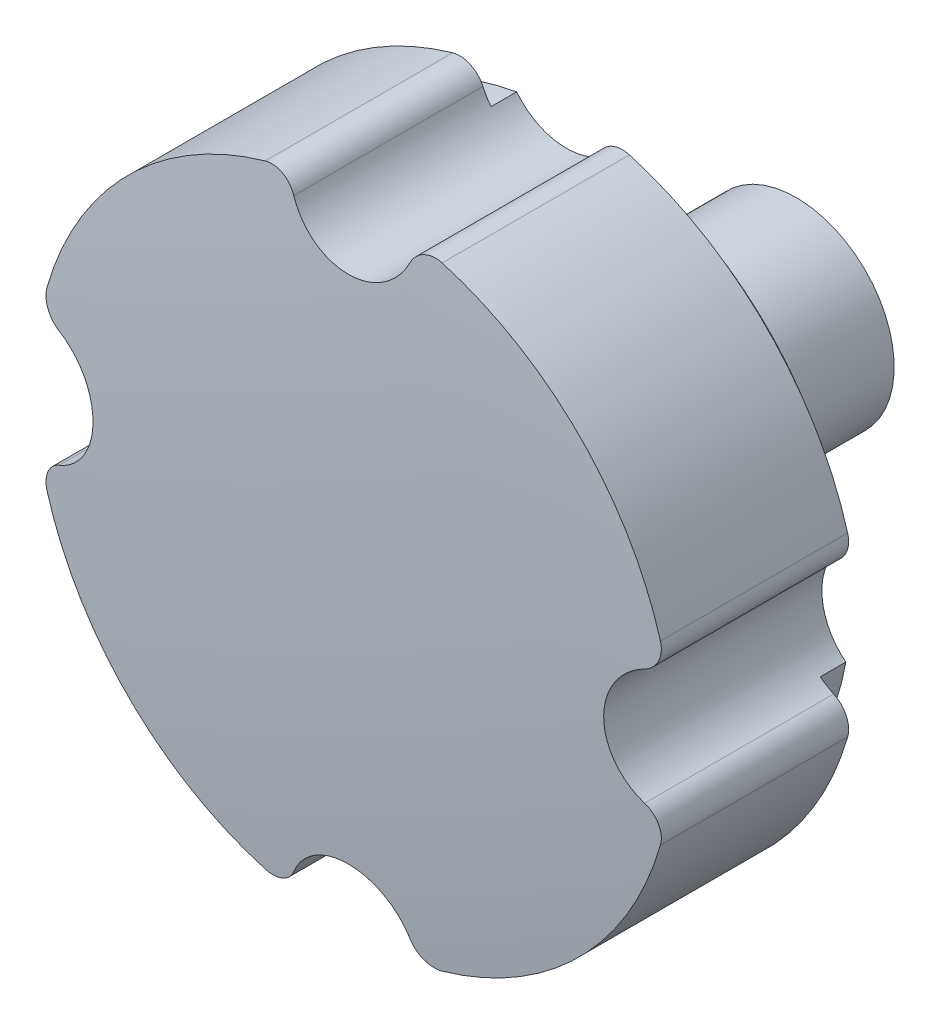
from build123d import *

# Parameters (mm, degrees)
CUT_EXTRUDE1_REACH = 77.517
SKETCH2_R          = 7.5
FILLET1_R          = 3


with BuildPart() as part:
    # Sketch1 → Revolve1 (revolve)
    with BuildSketch(Plane(origin=(0, 0, 0), x_dir=(1, 0, 0), z_dir=(0, 1, 0))):
        with BuildLine():
            Line((0, 23.761691948), (0, 0))
            ThreePointArc((0, 0), (-18.770678987, 0.44066572), (-37.5, 1.761691948))
            Line((-37.5, 1.761691948), (-37.5, 23.761691948))
            Line((-37.5, 23.761691948), (-33.34, 23.761691948))
            Line((-33.34, 23.761691948), (-33.34, 26.761691948))
            Line((-33.34, 26.761691948), (-11.5, 26.761691948))
            Line((-11.5, 26.761691948), (-11.5, 53.761691948))
            Line((-11.5, 53.761691948), (-6, 53.761691948))
            Line((-6, 53.761691948), (-6, 23.761691948))
            Line((-6, 23.761691948), (0, 23.761691948))
        make_face()
    revolve(axis=Axis((0, 0, -358.843484937), (0, 0, 1)))

    # Sketch2 → Cut-Extrude1 (cut, up to next)
    with BuildSketch(Plane.XY, mode=Mode.PRIVATE) as cut_extrude1_sk1:
        with Locations((0, 37.5)):
            Circle(SKETCH2_R)
    cut_extrude1_tool1 = extrude(cut_extrude1_sk1.sketch, amount=-CUT_EXTRUDE1_REACH, mode=Mode.PRIVATE) & part.part
    # Sketch2 → Cut-Extrude1 (cut, up to next)
    with BuildSketch(Plane.XY, mode=Mode.PRIVATE) as cut_extrude1_sk2:
        with Locations((37.5, 0)):
            Circle(SKETCH2_R)
    cut_extrude1_tool2 = extrude(cut_extrude1_sk2.sketch, amount=-CUT_EXTRUDE1_REACH, mode=Mode.PRIVATE) & part.part
    # Sketch2 → Cut-Extrude1 (cut, up to next)
    with BuildSketch(Plane.XY, mode=Mode.PRIVATE) as cut_extrude1_sk3:
        with Locations((0, -37.5)):
            Circle(SKETCH2_R)
    cut_extrude1_tool3 = extrude(cut_extrude1_sk3.sketch, amount=-CUT_EXTRUDE1_REACH, mode=Mode.PRIVATE) & part.part
    # Sketch2 → Cut-Extrude1 (cut, up to next)
    with BuildSketch(Plane.XY, mode=Mode.PRIVATE) as cut_extrude1_sk4:
        with Locations((-37.5, 0)):
            Circle(SKETCH2_R)
    cut_extrude1_tool4 = extrude(cut_extrude1_sk4.sketch, amount=-CUT_EXTRUDE1_REACH, mode=Mode.PRIVATE) & part.part
    add(cut_extrude1_tool1.solids().sort_by_distance((0, 37.5, 0))[0], mode=Mode.SUBTRACT)
    add(cut_extrude1_tool2.solids().sort_by_distance((37.5, 0, 0))[0], mode=Mode.SUBTRACT)
    add(cut_extrude1_tool3.solids().sort_by_distance((0, -37.5, 0))[0], mode=Mode.SUBTRACT)
    add(cut_extrude1_tool4.solids().sort_by_distance((-37.5, 0, 0))[0], mode=Mode.SUBTRACT)

    # Fillet1
    # the kernel refuses this fillet: 3 mm, written as the material it takes off along each edge
    with BuildSketch(Plane(origin=(-36.75, -7.462405778, -31.291256689), x_dir=(0.9654419045574989, 0.26061835876313283, 0), z_dir=(0, 0, 1))) as fillet1_piece_1:
        with BuildLine():
            CenterArc((2.929820443, -2.959993207), FILLET1_R, 99.367586043, 81.606967112)
            ThreePointArc((-0.0697456, -3.01101823), (-0.065113873, -1.504808627), (0, 0))
            ThreePointArc((0, 0), (1.220758518, -0.100016984), (2.441517036, 0))
        make_face()
    extrude(amount=37.059130081, mode=Mode.SUBTRACT)
    with BuildSketch(Plane(origin=(-36.75, 7.462405778, -31.291256689), x_dir=(0.9654419045574933, -0.26061835876315326, 0), z_dir=(0, 0, 1))) as fillet1_piece_2:
        with BuildLine():
            CenterArc((2.929820443, 2.959993207), FILLET1_R, 179.025446846, 81.606967112)
            ThreePointArc((-0.0697456, 3.01101823), (-0.065113873, 1.504808627), (0, 0))
            ThreePointArc((0, 0), (1.220758518, 0.100016984), (2.441517036, 0))
        make_face()
    extrude(amount=37.059129481, mode=Mode.SUBTRACT)
    with BuildSketch(Plane(origin=(7.462405778, -36.75, -31.291256689), x_dir=(-0.26061835876313594, 0.9654419045574982, 0), z_dir=(0, 0, 1)), Plane(origin=(36.75, 7.462405778, -31.291256689), x_dir=(-0.9654419045574977, -0.2606183587631379, 0), z_dir=(0, 0, 1)), Plane(origin=(-7.462405778, 36.75, -31.291256689), x_dir=(0.2606183587631421, -0.9654419045574966, 0), z_dir=(0, 0, 1))) as fillet1_piece_3:
        with BuildLine():
            CenterArc((2.929820443, -2.959993207), FILLET1_R, 99.367586043, 81.606967112)
            ThreePointArc((-0.0697456, -3.01101823), (-0.065113873, -1.504808627), (0, 0))
            ThreePointArc((0, 0), (1.220758518, -0.100016984), (2.441517036, 0))
        make_face()
    extrude(amount=37.059129481, mode=Mode.SUBTRACT)
    with BuildSketch(Plane(origin=(-7.462405778, -36.75, -31.291256689), x_dir=(-0.9712182108388207, 0.238191492155031, 0), z_dir=(0, 0, 1)), Plane(origin=(36.75, -7.462405778, -31.291256689), x_dir=(-0.23819149215502627, -0.9712182108388219, 0), z_dir=(0, 0, 1)), Plane(origin=(7.462405778, 36.75, -31.291256689), x_dir=(0.9712182108388221, -0.2381914921550248, 0), z_dir=(0, 0, 1))) as fillet1_piece_4:
        with BuildLine():
            CenterArc((2.89135286, -2.997580065), FILLET1_R, 87.69851564, 81.606967112)
            ThreePointArc((-0.056538816, -2.440862306), (0.071720755, -1.222747271), (0, 0))
            ThreePointArc((0, 0), (1.505912948, 0.030249184), (3.011825896, 0))
        make_face()
    extrude(amount=37.059129481, mode=Mode.SUBTRACT)


solid = part.part
